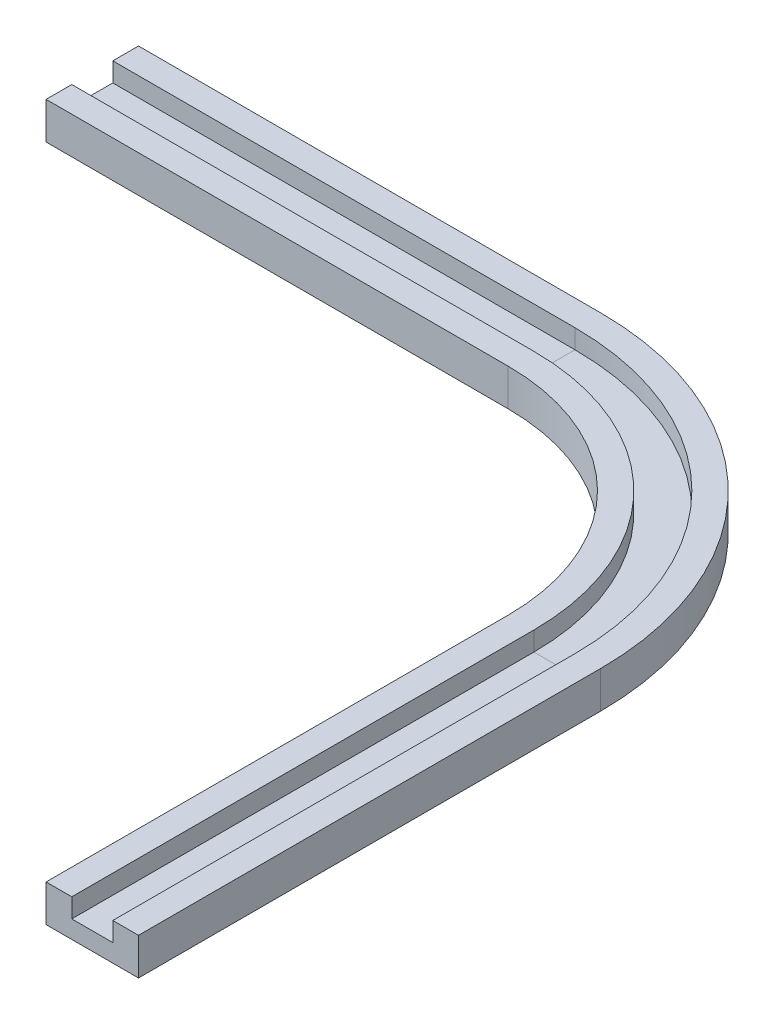
from build123d import *
from OCP.BRepAlgoAPI import BRepAlgoAPI_Cut
from OCP.TopTools import TopTools_ListOfShape

# Parameters (mm, degrees)
BOSS_EXTRUDE1_DEPTH = 8
SKETCH3_W           = 8.879033142
SKETCH3_H           = 4.145705198


with BuildPart() as part:
    # Sketch1 → Boss-Extrude1 (new body)
    with BuildSketch(Plane(origin=(0, 0, 0), x_dir=(1, 0, 0), z_dir=(0, 1, 0))):
        with BuildLine():
            Line((-63.148507742, 16.718633156), (36.851492258, 16.718633156))
            ThreePointArc((36.851492258, 16.718633156), (69.836689376, 3.055714409), (83.499598758, -29.92948659))
            Line((83.499598758, -29.92948659), (83.499598758, -129.929492269))
            Line((83.499598758, -129.929492269), (103.499598758, -129.929492269))
            Line((103.499598758, -129.929492269), (103.499598758, -29.929492269))
            ThreePointArc((103.499598758, -29.929492269), (83.978827008, 17.197848025), (36.851492258, 36.718633156))
            Line((36.851492258, 36.718633156), (-63.148507742, 36.718633156))
            Line((-63.148507742, 36.718633156), (-63.148507742, 16.718633156))
        make_face()
    extrude(amount=BOSS_EXTRUDE1_DEPTH)


with BuildPart() as cut_sweep1_tool:
    # Cut-Sweep1: sweep along a path in Sketch2
    with BuildLine(Plane(origin=(0, 8, 0), x_dir=(1, 0, 0), z_dir=(0, 1, 0))) as cut_sweep1_path:
        Line((-63.148507742, 26.718633156), (36.851492258, 26.718633156))
        ThreePointArc((36.851492258, 26.718633156), (76.907758192, 10.126781217), (93.499598758, -29.929489429))
        Line((93.499598758, -29.929489429), (93.499598758, -129.929492269))
    # Sketch3 → Cut-Sweep1 (sweep)
    with BuildSketch(Plane.ZY.offset(63.148507742)):
        with Locations((-26.718633156, 5.927147401)):
            Rectangle(SKETCH3_W, SKETCH3_H)
    sweep(path=cut_sweep1_path.line)


with BuildPart() as part_1:
    add(part.part)

    # Cut-Sweep1: cut by cut_sweep1_tool, with a tolerance
    cut_sweep1_stock = TopTools_ListOfShape()
    cut_sweep1_stock.Append(part_1.part.wrapped)
    cut_sweep1_tools = TopTools_ListOfShape()
    cut_sweep1_tools.Append(cut_sweep1_tool.part.wrapped)
    cut_sweep1_cut = BRepAlgoAPI_Cut()
    cut_sweep1_cut.SetArguments(cut_sweep1_stock)
    cut_sweep1_cut.SetTools(cut_sweep1_tools)
    cut_sweep1_cut.SetFuzzyValue(0.00001)
    cut_sweep1_cut.Build()
    add(Compound.cast(cut_sweep1_cut.Shape()).solids(), mode=Mode.REPLACE)


solid = part_1.part
